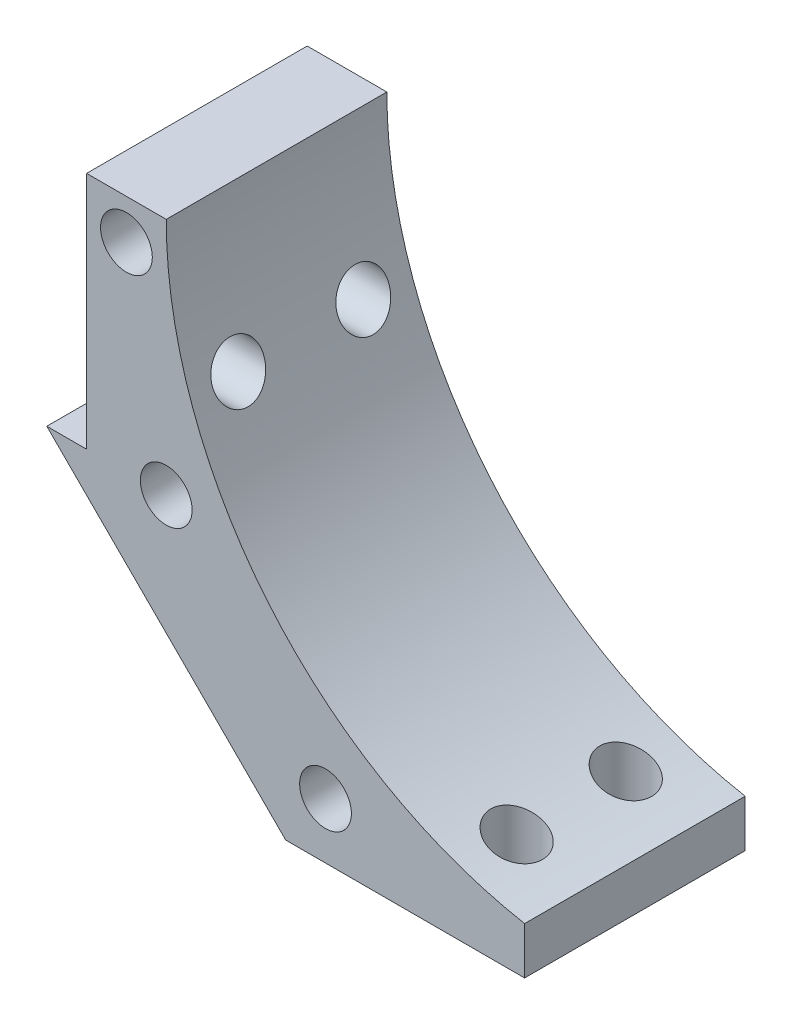
from build123d import *

# Parameters (mm, degrees)
EXTRUDE_1_DEPTH     = 27.7
CUT_EXTRUDE_1_DEPTH = 40
SKETCH_4_R          = 3.25
CUT_EXTRUDE_2_DEPTH = 90.259677346
SKETCH_5_R          = 3.25
CUT_EXTRUDE_3_DEPTH = 86.978427527
SKETCH_6_R          = 3.25
CUT_EXTRUDE_4_DEPTH = 90.259677512


with BuildPart() as part:
    # 草图1 → 凸台-拉伸1 (new body)
    with BuildSketch(Plane.XY):
        Polygon((5, 30), (0, 30), (30, 0), (60, 0), (60, 30), (30, 30), (30, 60), (5, 60), align=None)
    extrude(amount=EXTRUDE_1_DEPTH)

    # 草图3 → 切除-拉伸1 (cut)
    with BuildSketch(Plane.XY.offset(27.7)):
        with BuildLine():
            ThreePointArc((15, 60), (27.721163687, 24.821881801), (60, 5.916730868))
            Line((60, 5.916730868), (60, 30))
            Line((60, 30), (30, 30))
            Line((30, 30), (30, 60))
            Line((30, 60), (15, 60))
        make_face()
    extrude(amount=-CUT_EXTRUDE_1_DEPTH, mode=Mode.SUBTRACT)

    # 草图4 → 切除-拉伸2 (cut, through all)
    with BuildSketch(Plane.XY.offset(27.7)):
        with Locations((35, 7)):
            Circle(SKETCH_4_R)
        with Locations((10, 55)):
            Circle(SKETCH_4_R)
        with Locations((15, 30)):
            Circle(SKETCH_4_R)
    extrude(amount=-CUT_EXTRUDE_2_DEPTH, mode=Mode.SUBTRACT)

    # 草图5 → 切除-拉伸3 (cut, through all)
    with BuildSketch(Plane.ZY.offset(-5)):
        with Locations((6, 42)):
            Circle(SKETCH_5_R)
        with Locations((21.7, 42)):
            Circle(SKETCH_5_R)
    extrude(amount=-CUT_EXTRUDE_3_DEPTH, mode=Mode.SUBTRACT)

    # 草图6 → 切除-拉伸4 (cut, through all)
    with BuildSketch(Plane.XZ):
        with Locations((52, 20.7)):
            Circle(SKETCH_6_R)
        with Locations((52, 7)):
            Circle(SKETCH_6_R)
    extrude(amount=-CUT_EXTRUDE_4_DEPTH, mode=Mode.SUBTRACT)


solid = part.part
